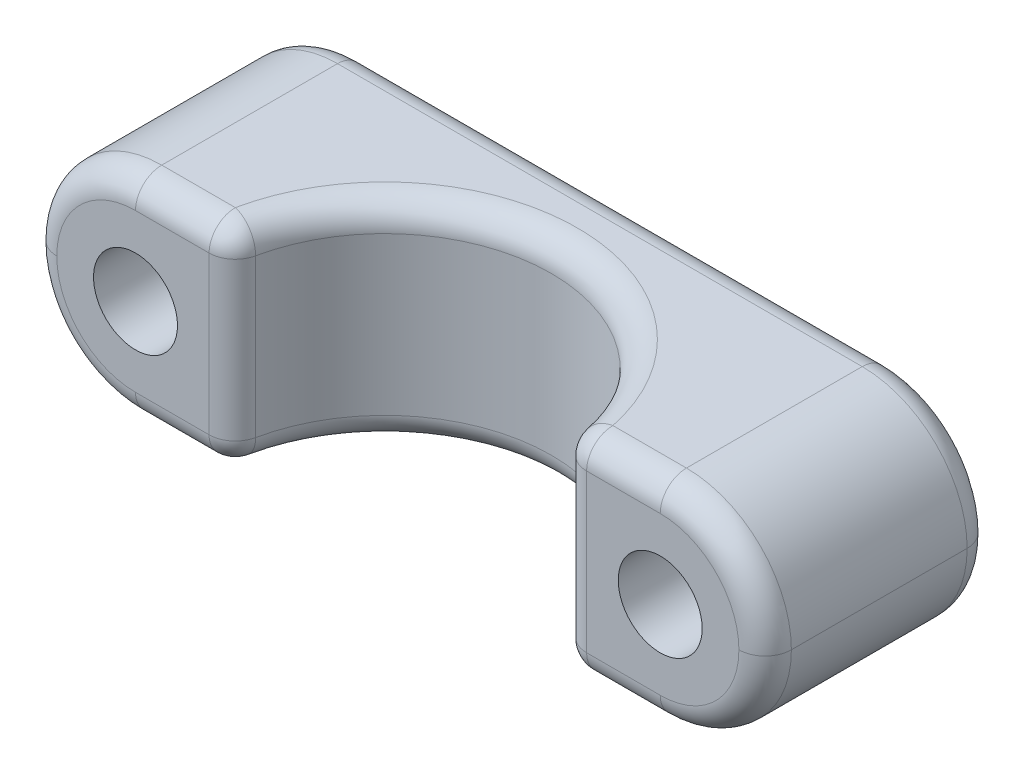
from build123d import *

# Parameters (mm, degrees)
EXTRUDE_1_DEPTH     = 8
FILLET_1_R          = 4
SKETCH_3_R          = 0.75
CUT_EXTRUDE_1_DEPTH = 3
SKETCH_4_R          = 1.6
CUT_EXTRUDE_2_DEPTH = 19.321844885
SKETCH_5_R          = 3
CUT_EXTRUDE_3_DEPTH = 2
FILLET_3_R          = 1
FILLET_2_R          = 1
SKETCH_6_W          = 12.9
SKETCH_6_H          = 1
EXTRUDE_2_DEPTH     = 1


# Some blends are built 0.0001 mm under size
with BuildPart() as part:
    # Эскиз1 → Бобышка-Вытянуть1 (new body)
    with BuildSketch(Plane(origin=(0, 0, 0), x_dir=(1, 0, 0), z_dir=(0, 1, 0))):
        with BuildLine():
            Line((14, 9.2), (-14, 9.2))
            Line((-14, 9.2), (-14, 0.5))
            Line((-14, 0.5), (-6.330284354, 0.5))
            ThreePointArc((-6.330284354, 0.5), (0, 6.35), (6.330284354, 0.5))
            Line((6.330284354, 0.5), (14, 0.5))
            Line((14, 0.5), (14, 9.2))
        make_face()
    extrude(amount=EXTRUDE_1_DEPTH)

    # Скругление1
    fillet_1_edges = [part.edges().sort_by_distance(p)[0] for p in [
        (14, 0, -4.85),
        (14, 8, -4.85),
        (-14, 0, -4.85),
        (-14, 8, -4.85),
    ]]
    fillet(fillet_1_edges, radius=FILLET_1_R - 0.0001)  # a hair under: the kernel refuses the full size

    # Эскиз3 → Вырез-Вытянуть1 (cut)
    with BuildSketch(Plane.XY.offset(-9.2)):
        with Locations((-3.25, 4)):
            Circle(SKETCH_3_R)
        with Locations((3.25, 4)):
            Circle(SKETCH_3_R)
    extrude(amount=CUT_EXTRUDE_1_DEPTH, mode=Mode.SUBTRACT)

    # Эскиз4 → Вырез-Вытянуть2 (cut, through all)
    with BuildSketch(Plane.XY.offset(-0.5)):
        with Locations((-10, 4)):
            Circle(SKETCH_4_R)
        with Locations((10, 4)):
            Circle(SKETCH_4_R)
    extrude(amount=-CUT_EXTRUDE_2_DEPTH, mode=Mode.SUBTRACT)

    # Эскиз5 → Вырез-Вытянуть3 (cut)
    with BuildSketch(Plane(origin=(0, 0, -9.2), x_dir=(-1, 0, 0), z_dir=(0, 0, -1))):
        with Locations((-10, 4)):
            Circle(SKETCH_5_R)
        with Locations((10, 4)):
            Circle(SKETCH_5_R)
    extrude(amount=-CUT_EXTRUDE_3_DEPTH, mode=Mode.SUBTRACT)

    # Скругление3
    # the kernel refuses this fillet: 1 mm, written as the material it takes off along each edge
    with BuildSketch(Plane(origin=(10.0001, 4.0001, -9.2), x_dir=(1, 0, 0), z_dir=(0, -1, 0))) as fillet_3_piece_1:
        with BuildLine():
            CenterArc((3.9999 - FILLET_3_R, FILLET_3_R), FILLET_3_R, 270, 90)
            Line((3.9999 - FILLET_3_R, 0), (3.9999, 0))
            Line((3.9999, 0), (3.9999, FILLET_3_R))
        make_face()
    revolve(axis=Axis((10.0001, 4.0001, -9.2), (0, 0, 1)), revolution_arc=90, mode=Mode.SUBTRACT)
    with BuildSketch(Plane(origin=(10.0001, 3.9999, -9.2), x_dir=(1, 0, 0), z_dir=(0, 1, 0))) as fillet_3_piece_2:
        with BuildLine():
            CenterArc((3.9999 - FILLET_3_R, -FILLET_3_R), FILLET_3_R, 0, 90)
            Line((3.9999 - FILLET_3_R, 0), (3.9999, 0))
            Line((3.9999, 0), (3.9999, -FILLET_3_R))
        make_face()
    revolve(axis=Axis((10.0001, 3.9999, -9.2), (0, 0, -1)), revolution_arc=90, mode=Mode.SUBTRACT)
    with BuildSketch(Plane(origin=(10.0001, 0, -9.2), x_dir=(0, 0, 1), z_dir=(-1, 0, 0))) as fillet_3_piece_3:
        with BuildLine():
            CenterArc((FILLET_3_R, FILLET_3_R), FILLET_3_R, 180, 90)
            Line((0, FILLET_3_R), (0, 0))
            Line((0, 0), (FILLET_3_R, 0))
        make_face()
    extrude(amount=20.0002, mode=Mode.SUBTRACT)
    with BuildSketch(Plane(origin=(-10.0001, 3.9999, -9.2), x_dir=(-1, 0, 0), z_dir=(0, 1, 0))) as fillet_3_piece_4:
        with BuildLine():
            CenterArc((3.9999 - FILLET_3_R, FILLET_3_R), FILLET_3_R, 270, 90)
            Line((3.9999, FILLET_3_R), (3.9999, 0))
            Line((3.9999, 0), (3.9999 - FILLET_3_R, 0))
        make_face()
    revolve(axis=Axis((-10.0001, 3.9999, -9.2), (0, 0, 1)), revolution_arc=90, mode=Mode.SUBTRACT)
    with BuildSketch(Plane(origin=(-10.0001, 4.0001, -9.2), x_dir=(-1, 0, 0), z_dir=(0, -1, 0))) as fillet_3_piece_5:
        with BuildLine():
            CenterArc((3.9999 - FILLET_3_R, -FILLET_3_R), FILLET_3_R, 360, 90)
            Line((3.9999, -FILLET_3_R), (3.9999, 0))
            Line((3.9999, 0), (3.9999 - FILLET_3_R, 0))
        make_face()
    revolve(axis=Axis((-10.0001, 4.0001, -9.2), (0, 0, -1)), revolution_arc=90, mode=Mode.SUBTRACT)
    with BuildSketch(Plane(origin=(10.0001, 8, -9.2), x_dir=(0, 0, 1), z_dir=(-1, 0, 0))) as fillet_3_piece_6:
        with BuildLine():
            CenterArc((FILLET_3_R, -FILLET_3_R), FILLET_3_R, 90, 90)
            Line((0, -FILLET_3_R), (0, 0))
            Line((0, 0), (FILLET_3_R, 0))
        make_face()
    extrude(amount=20.0002, mode=Mode.SUBTRACT)
    with BuildSketch(Plane(origin=(-10, 4, -9.2), x_dir=(-1, 0, 0), z_dir=(0, -1, 0))) as fillet_3_piece_7:
        with BuildLine():
            CenterArc((3 + FILLET_3_R, -FILLET_3_R), FILLET_3_R, 90, 90)
            Line((3, -FILLET_3_R), (3, 0))
            Line((3, 0), (3 + FILLET_3_R, 0))
        make_face()
    revolve(axis=Axis((-10, 4, -9.2), (0, 0, -1)), mode=Mode.SUBTRACT)
    with BuildSketch(Plane(origin=(10, 4, -9.2), x_dir=(-1, 0, 0), z_dir=(0, -1, 0))) as fillet_3_piece_8:
        with BuildLine():
            CenterArc((3 + FILLET_3_R, -FILLET_3_R), FILLET_3_R, 90, 90)
            Line((3, -FILLET_3_R), (3, 0))
            Line((3, 0), (3 + FILLET_3_R, 0))
        make_face()
    revolve(axis=Axis((10, 4, -9.2), (0, 0, -1)), mode=Mode.SUBTRACT)
    with BuildSketch(Plane(origin=(-14, 3.9999, -9.2), x_dir=(1, 0, 0), z_dir=(0, 1, 0)), Plane(origin=(14, 3.9999, -9.2), x_dir=(0, 0, 1), z_dir=(0, 1, 0))) as fillet_3_piece_9:
        with BuildLine():
            CenterArc((FILLET_3_R, -FILLET_3_R), FILLET_3_R, 90, 90)
            Line((0, -FILLET_3_R), (0, 0))
            Line((0, 0), (FILLET_3_R, 0))
        make_face()
    extrude(amount=0.0002, mode=Mode.SUBTRACT)

    # Скругление2
    fillet_2_edges = [part.edges().sort_by_distance(p)[0] for p in [
        (0, 8, -6.35),
        (6.330284354, 4, -0.5),
        (-6.330284354, 4, -0.5),
        (8.165192177, 8, -0.5),
        (-8.165192177, 0, -0.5),
        (12.828456414, 6.828456414, -0.5),
        (12.828456414, 1.171543586, -0.5),
        (-8.165192177, 8, -0.5),
        (-12.828456414, 6.828456414, -0.5),
        (-12.828456414, 1.171543586, -0.5),
        (8.165192177, 0, -0.5),
        (0, 0, -6.35),
    ]]
    fillet(fillet_2_edges, radius=FILLET_2_R)

    # Эскиз6 → Бобышка-Вытянуть2 (add)
    with BuildSketch(Plane(origin=(0, 0, -9.2), x_dir=(-1, 0, 0), z_dir=(0, 0, -1))):
        with Locations((0, 0.5)):
            Rectangle(SKETCH_6_W, SKETCH_6_H)
    extrude(amount=-EXTRUDE_2_DEPTH)


solid = part.part
